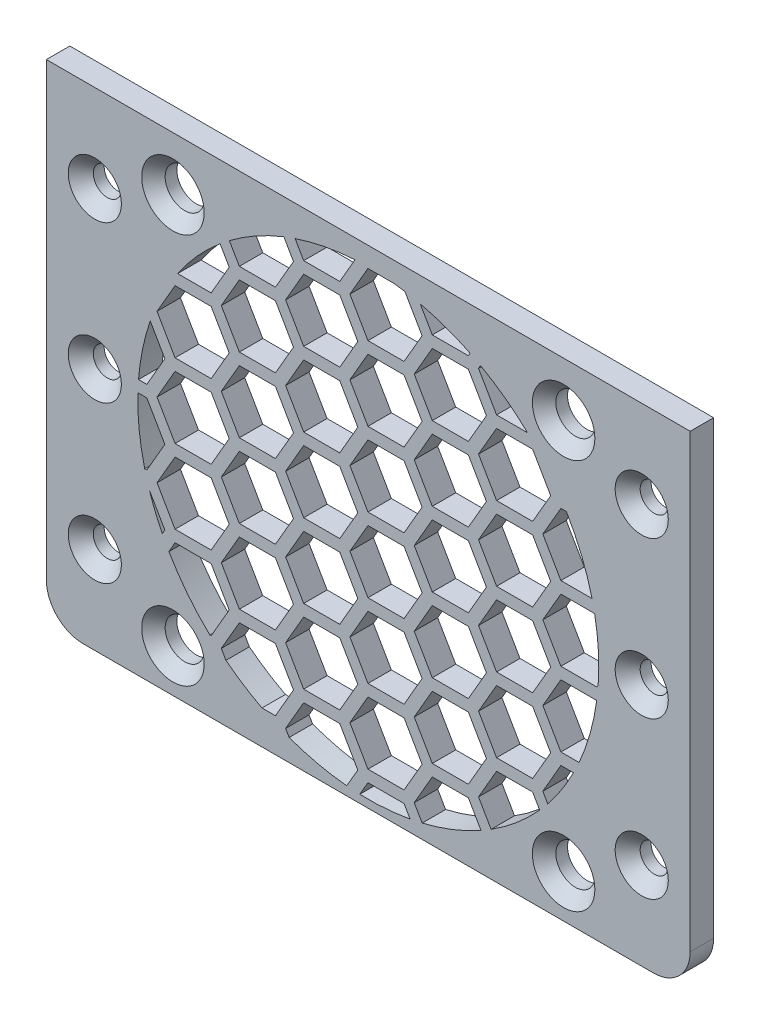
from build123d import *

# Parameters (mm, degrees)
SKETCH1_W                                       = 11
SKETCH1_H                                       = 63
SKETCH1_W_2                                     = 60
SKETCH1_H_2                                     = 60
BOSS_EXTRUDE1_DEPTH                             = 3
CSK_FOR_M3_FLAT_HEAD_MACHINE_SCREW1_D           = 3.6
CSK_FOR_M3_FLAT_HEAD_MACHINE_SCREW1_DEPTH       = 6
CSK_FOR_M3_FLAT_HEAD_MACHINE_SCREW1_CSINK_D     = 6.8
CSK_FOR_M3_FLAT_HEAD_MACHINE_SCREW1_CSINK_ANGLE = 90
CSK_FOR_M3_FLAT_HEAD_MACHINE_SCREW1_TIP         = 1.081549114
FILLET1_R                                       = 5
CUT_EXTRUDE1_DEPTH                              = 96.718336801
CSK_FOR_M4_FLAT_HEAD_MACHINE_SCREW1_D           = 5
CSK_FOR_M4_FLAT_HEAD_MACHINE_SCREW1_DEPTH       = 7
CSK_FOR_M4_FLAT_HEAD_MACHINE_SCREW1_CSINK_D     = 8
CSK_FOR_M4_FLAT_HEAD_MACHINE_SCREW1_CSINK_ANGLE = 90
CSK_FOR_M4_FLAT_HEAD_MACHINE_SCREW1_TIP         = 1.502151548
SKETCH8_R                                       = 29.5
CUT_EXTRUDE2_DEPTH                              = 96.295225484
BOSS_EXTRUDE2_START                             = -3
BOSS_EXTRUDE2_DEPTH                             = 3


# Read off the part's stored shape, not the designer's step: Boss-Extrude2
with BuildPart() as part:
    # Sketch1 → Boss-Extrude1 (new body)
    with BuildSketch(Plane.XY):
        with Locations((-66.5, 31.5)):
            Rectangle(SKETCH1_W, SKETCH1_H)
        Polygon((-60, 60), (0, 60), (0, 63), (-61, 63), (-61, 0), (-60, 0), align=None)
        with Locations((-30, 30)):
            Rectangle(SKETCH1_W_2, SKETCH1_H_2)
        with Locations((5.5, 31.5)):
            Rectangle(SKETCH1_W, SKETCH1_H)
    extrude(amount=BOSS_EXTRUDE1_DEPTH)

    # CSK for M3 Flat Head Machine Screw1
    with Locations(Plane.XY.offset(3)):
        with Locations((-65.5, 31.5), (-65.5, 51.5), (-65.5, 11.5), (4.5, 11.5), (4.5, 31.5), (4.5, 51.5)):
            CounterSinkHole(CSK_FOR_M3_FLAT_HEAD_MACHINE_SCREW1_D / 2, CSK_FOR_M3_FLAT_HEAD_MACHINE_SCREW1_CSINK_D / 2, depth=CSK_FOR_M3_FLAT_HEAD_MACHINE_SCREW1_DEPTH, counter_sink_angle=CSK_FOR_M3_FLAT_HEAD_MACHINE_SCREW1_CSINK_ANGLE)
            with Locations((0, 0, -(CSK_FOR_M3_FLAT_HEAD_MACHINE_SCREW1_DEPTH + CSK_FOR_M3_FLAT_HEAD_MACHINE_SCREW1_TIP / 2))):  # 118° drill point
                Cone(0, CSK_FOR_M3_FLAT_HEAD_MACHINE_SCREW1_D / 2, CSK_FOR_M3_FLAT_HEAD_MACHINE_SCREW1_TIP, mode=Mode.SUBTRACT)

    # Fillet1
    fillet1_edges = [part.edges().sort_by_distance(p)[0] for p in [
        (11, 0, 1.5),
        (-72, 0, 1.5),
    ]]
    fillet(fillet1_edges, radius=FILLET1_R)

    # Sketch4 → Cut-Extrude1 (cut, through all)
    with BuildSketch(Plane.XY.offset(3)):
        with BuildLine():
            Line((11, 5), (11, 63))
            Line((11, 63), (-72, 63))
            Line((-72, 63), (-72, 5))
            ThreePointArc((-72, 5), (-70.535533906, 1.464466094), (-67, 0))
            Line((-67, 0), (6, 0))
            ThreePointArc((6, 0), (9.535533906, 1.464466094), (11, 5))
        make_face()
        with BuildLine():
            Line((10.7, 5), (10.7, 62.7))
            Line((10.7, 62.7), (-71.7, 62.7))
            Line((-71.7, 62.7), (-71.7, 5))
            ThreePointArc((-71.7, 5), (-70.323401872, 1.676598128), (-67, 0.3))
            Line((-67, 0.3), (6, 0.3))
            ThreePointArc((6, 0.3), (9.323401872, 1.676598128), (10.7, 5))
        make_face(mode=Mode.SUBTRACT)
    extrude(amount=-CUT_EXTRUDE1_DEPTH, mode=Mode.SUBTRACT)

    # CSK for M4 Flat Head Machine Screw1
    with Locations(Plane.XY.offset(3)):
        with Locations((-55.5, 55.8), (-5.5, 55.8), (-5.5, 5.8), (-55.5, 5.8)):
            CounterSinkHole(CSK_FOR_M4_FLAT_HEAD_MACHINE_SCREW1_D / 2, CSK_FOR_M4_FLAT_HEAD_MACHINE_SCREW1_CSINK_D / 2, depth=CSK_FOR_M4_FLAT_HEAD_MACHINE_SCREW1_DEPTH, counter_sink_angle=CSK_FOR_M4_FLAT_HEAD_MACHINE_SCREW1_CSINK_ANGLE)
            with Locations((0, 0, -(CSK_FOR_M4_FLAT_HEAD_MACHINE_SCREW1_DEPTH + CSK_FOR_M4_FLAT_HEAD_MACHINE_SCREW1_TIP / 2))):  # 118° drill point
                Cone(0, CSK_FOR_M4_FLAT_HEAD_MACHINE_SCREW1_D / 2, CSK_FOR_M4_FLAT_HEAD_MACHINE_SCREW1_TIP, mode=Mode.SUBTRACT)

    # Sketch8 → Cut-Extrude2 (cut, through all)
    with BuildSketch(Plane.XY.offset(3)):
        with Locations((-30.5, 30.8)):
            Circle(SKETCH8_R)
    extrude(amount=-CUT_EXTRUDE2_DEPTH, mode=Mode.SUBTRACT)

    # Boss-Extrude2 outline → Boss-Extrude2 (add)
    with BuildSketch(Plane.XY.offset(3).offset(BOSS_EXTRUDE2_START)):
        with BuildLine():
            Line((-5.849401077, 36.375), (-1.531579694, 36.375))
            ThreePointArc((-1.531579694, 36.375), (-1.686509211, 37.127143789), (-1.86096414, 37.875))
            Line((-1.86096414, 37.875), (-5.849401077, 37.875))
            Line((-5.849401077, 37.875), (-8.158802154, 41.875))
            Line((-8.158802154, 41.875), (-5.849401077, 45.875))
            Line((-5.849401077, 45.875), (-5.142666248, 45.875))
            ThreePointArc((-5.142666248, 45.875), (-7.416982651, 49.169112936), (-10.116320867, 52.125))
            Line((-10.116320867, 52.125), (-14.082159741, 52.125))
            Line((-14.082159741, 52.125), (-16.391560818, 56.125))
            Line((-16.391560818, 56.125), (-16.136389783, 56.566969196))
            ThreePointArc((-16.136389783, 56.566969196), (-16.796670475, 56.924103046), (-17.465824519, 57.264320689))
            Line((-17.465824519, 57.264320689), (-17.690598923, 56.875))
            Line((-17.690598923, 56.875), (-22.309401077, 56.875))
            Line((-22.309401077, 56.875), (-23.848199791, 59.540277556))
            ThreePointArc((-23.848199791, 59.540277556), (-24.824620536, 59.748921706), (-25.80754281, 59.924402921))
            Line((-25.80754281, 59.924402921), (-23.613956511, 56.125))
            Line((-23.613956511, 56.125), (-25.923357587, 52.125))
            Line((-25.923357587, 52.125), (-30.542159741, 52.125))
            Line((-30.542159741, 52.125), (-32.851560818, 56.125))
            Line((-32.851560818, 56.125), (-30.542159741, 60.125))
            Line((-30.542159741, 60.125), (-27.291515155, 60.125))
            ThreePointArc((-27.291515155, 60.125), (-29.743897611, 60.290308733), (-32.20152913, 60.250887909))
            Line((-32.20152913, 60.250887909), (-34.150598923, 56.875))
            Line((-34.150598923, 56.875), (-38.769401077, 56.875))
            Line((-38.769401077, 56.875), (-39.865679548, 58.773810012))
            ThreePointArc((-39.865679548, 58.773810012), (-40.587020298, 58.521869012), (-41.301594176, 58.25133081))
            Line((-41.301594176, 58.25133081), (-40.073956511, 56.125))
            Line((-40.073956511, 56.125), (-42.383357587, 52.125))
            Line((-42.383357587, 52.125), (-47.002159741, 52.125))
            Line((-47.002159741, 52.125), (-48.280604386, 54.33933108))
            ThreePointArc((-48.280604386, 54.33933108), (-48.879893301, 53.874434386), (-49.467032243, 53.394284408))
            Line((-49.467032243, 53.394284408), (-48.301197846, 51.375))
            Line((-48.301197846, 51.375), (-50.610598923, 47.375))
            Line((-50.610598923, 47.375), (-54.903265663, 47.375))
            ThreePointArc((-54.903265663, 47.375), (-56.888142818, 43.987718477), (-58.405646971, 40.366862973))
            Line((-58.405646971, 40.366862973), (-56.533956511, 37.125))
            Line((-56.533956511, 37.125), (-58.843357587, 33.125))
            Line((-58.843357587, 33.125), (-59.908236516, 33.125))
            ThreePointArc((-59.908236516, 33.125), (-59.957898194, 32.375510718), (-59.988461727, 31.625))
            Line((-59.988461727, 31.625), (-58.843357587, 31.625))
            Line((-58.843357587, 31.625), (-56.533956511, 27.625))
            Line((-56.533956511, 27.625), (-58.843357587, 23.625))
            Line((-58.843357587, 23.625), (-59.114146414, 23.625))
            ThreePointArc((-59.114146414, 23.625), (-58.832742538, 22.583814737), (-58.513466555, 21.55361197))
            Line((-58.513466555, 21.55361197), (-56.533956511, 18.125))
            Line((-56.533956511, 18.125), (-56.861116881, 17.558341616))
            ThreePointArc((-56.861116881, 17.558341616), (-56.452720902, 16.774798475), (-56.021041965, 16.00383776))
            Line((-56.021041965, 16.00383776), (-55.229401077, 17.375))
            Line((-55.229401077, 17.375), (-50.610598923, 17.375))
            Line((-50.610598923, 17.375), (-48.301197846, 13.375))
            Line((-48.301197846, 13.375), (-50.610598923, 9.375))
            Line((-50.610598923, 9.375), (-50.778544696, 9.375))
            ThreePointArc((-50.778544696, 9.375), (-49.769089131, 8.462761942), (-48.718644735, 7.59803922))
            Line((-48.718644735, 7.59803922), (-49.311560818, 8.625))
            Line((-49.311560818, 8.625), (-47.002159741, 12.625))
            Line((-47.002159741, 12.625), (-42.383357587, 12.625))
            Line((-42.383357587, 12.625), (-40.073956511, 8.625))
            Line((-40.073956511, 8.625), (-42.383357587, 4.625))
            Line((-42.383357587, 4.625), (-44.105858113, 4.625))
            ThreePointArc((-44.105858113, 4.625), (-42.391226993, 3.802801616), (-40.627186714, 3.092779113))
            Line((-40.627186714, 3.092779113), (-41.078802154, 3.875))
            Line((-41.078802154, 3.875), (-38.769401077, 7.875))
            Line((-38.769401077, 7.875), (-34.150598923, 7.875))
            Line((-34.150598923, 7.875), (-31.841197846, 3.875))
            Line((-31.841197846, 3.875), (-33.253519364, 1.428787374))
            ThreePointArc((-33.253519364, 1.428787374), (-32.419688772, 1.362527367), (-31.584314789, 1.319934508))
            Line((-31.584314789, 1.319934508), (-30.542159741, 3.125))
            Line((-30.542159741, 3.125), (-25.923357587, 3.125))
            Line((-25.923357587, 3.125), (-25.151919029, 1.788829222))
            ThreePointArc((-25.151919029, 1.788829222), (-24.375762939, 1.942700743), (-23.604012885, 2.117333428))
            Line((-23.604012885, 2.117333428), (-24.618802154, 3.875))
            Line((-24.618802154, 3.875), (-22.309401077, 7.875))
            Line((-22.309401077, 7.875), (-17.690598923, 7.875))
            Line((-17.690598923, 7.875), (-16.070920795, 5.069635189))
            ThreePointArc((-16.070920795, 5.069635189), (-15.421369208, 5.444825115), (-14.781567137, 5.836409146))
            Line((-14.781567137, 5.836409146), (-16.391560818, 8.625))
            Line((-16.391560818, 8.625), (-14.082159741, 12.625))
            Line((-14.082159741, 12.625), (-9.463357587, 12.625))
            Line((-9.463357587, 12.625), (-8.566841366, 11.072188354))
            ThreePointArc((-8.566841366, 11.072188354), (-8.040841719, 11.673154748), (-7.531303163, 12.288139866))
            Line((-7.531303163, 12.288139866), (-8.158802154, 13.375))
            Line((-8.158802154, 13.375), (-5.849401077, 17.375))
            Line((-5.849401077, 17.375), (-4.231780133, 17.375))
            ThreePointArc((-4.231780133, 17.375), (-3.864180165, 18.119972331), (-3.517702563, 18.875))
            Line((-3.517702563, 18.875), (-5.849401077, 18.875))
            Line((-5.849401077, 18.875), (-8.158802154, 22.875))
            Line((-8.158802154, 22.875), (-5.849401077, 26.875))
            Line((-5.849401077, 26.875), (-1.262278218, 26.875))
            ThreePointArc((-1.262278218, 26.875), (-1.157619859, 27.754556242), (-1.079415079, 28.6368581))
            Line((-1.079415079, 28.6368581), (-1.230598923, 28.375))
            Line((-1.230598923, 28.375), (-5.849401077, 28.375))
            Line((-5.849401077, 28.375), (-8.158802154, 32.375))
            Line((-8.158802154, 32.375), (-5.849401077, 36.375))
        make_face()
        Polygon((-31.841197846, 13.375), (-34.150598923, 9.375), (-38.769401077, 9.375), (-41.078802154, 13.375), (-38.769401077, 17.375), (-34.150598923, 17.375), align=None, mode=Mode.SUBTRACT)
        Polygon((-55.229401077, 26.875), (-50.610598923, 26.875), (-48.301197846, 22.875), (-50.610598923, 18.875), (-55.229401077, 18.875), (-57.538802154, 22.875), align=None, mode=Mode.SUBTRACT)
        Polygon((-47.002159741, 22.125), (-42.383357587, 22.125), (-40.073956511, 18.125), (-42.383357587, 14.125), (-47.002159741, 14.125), (-49.311560818, 18.125), align=None, mode=Mode.SUBTRACT)
        Polygon((-31.841197846, 22.875), (-34.150598923, 18.875), (-38.769401077, 18.875), (-41.078802154, 22.875), (-38.769401077, 26.875), (-34.150598923, 26.875), align=None, mode=Mode.SUBTRACT)
        Polygon((-47.002159741, 31.625), (-42.383357587, 31.625), (-40.073956511, 27.625), (-42.383357587, 23.625), (-47.002159741, 23.625), (-49.311560818, 27.625), align=None, mode=Mode.SUBTRACT)
        Polygon((-25.923357587, 12.625), (-23.613956511, 8.625), (-25.923357587, 4.625), (-30.542159741, 4.625), (-32.851560818, 8.625), (-30.542159741, 12.625), align=None, mode=Mode.SUBTRACT)
        Polygon((-15.381197846, 13.375), (-17.690598923, 9.375), (-22.309401077, 9.375), (-24.618802154, 13.375), (-22.309401077, 17.375), (-17.690598923, 17.375), align=None, mode=Mode.SUBTRACT)
        Polygon((-25.923357587, 22.125), (-23.613956511, 18.125), (-25.923357587, 14.125), (-30.542159741, 14.125), (-32.851560818, 18.125), (-30.542159741, 22.125), align=None, mode=Mode.SUBTRACT)
        Polygon((-22.309401077, 26.875), (-17.690598923, 26.875), (-15.381197846, 22.875), (-17.690598923, 18.875), (-22.309401077, 18.875), (-24.618802154, 22.875), align=None, mode=Mode.SUBTRACT)
        Polygon((-23.613956511, 27.625), (-25.923357587, 23.625), (-30.542159741, 23.625), (-32.851560818, 27.625), (-30.542159741, 31.625), (-25.923357587, 31.625), align=None, mode=Mode.SUBTRACT)
        Polygon((-9.463357587, 22.125), (-7.153956511, 18.125), (-9.463357587, 14.125), (-14.082159741, 14.125), (-16.391560818, 18.125), (-14.082159741, 22.125), align=None, mode=Mode.SUBTRACT)
        Polygon((-14.082159741, 31.625), (-9.463357587, 31.625), (-7.153956511, 27.625), (-9.463357587, 23.625), (-14.082159741, 23.625), (-16.391560818, 27.625), align=None, mode=Mode.SUBTRACT)
        Polygon((-55.229401077, 36.375), (-50.610598923, 36.375), (-48.301197846, 32.375), (-50.610598923, 28.375), (-55.229401077, 28.375), (-57.538802154, 32.375), align=None, mode=Mode.SUBTRACT)
        Polygon((-55.229401077, 45.875), (-50.610598923, 45.875), (-48.301197846, 41.875), (-50.610598923, 37.875), (-55.229401077, 37.875), (-57.538802154, 41.875), align=None, mode=Mode.SUBTRACT)
        Polygon((-47.002159741, 41.125), (-42.383357587, 41.125), (-40.073956511, 37.125), (-42.383357587, 33.125), (-47.002159741, 33.125), (-49.311560818, 37.125), align=None, mode=Mode.SUBTRACT)
        Polygon((-31.841197846, 32.375), (-34.150598923, 28.375), (-38.769401077, 28.375), (-41.078802154, 32.375), (-38.769401077, 36.375), (-34.150598923, 36.375), align=None, mode=Mode.SUBTRACT)
        Polygon((-34.150598923, 45.875), (-31.841197846, 41.875), (-34.150598923, 37.875), (-38.769401077, 37.875), (-41.078802154, 41.875), (-38.769401077, 45.875), align=None, mode=Mode.SUBTRACT)
        Polygon((-47.002159741, 50.625), (-42.383357587, 50.625), (-40.073956511, 46.625), (-42.383357587, 42.625), (-47.002159741, 42.625), (-49.311560818, 46.625), align=None, mode=Mode.SUBTRACT)
        Polygon((-34.150598923, 55.375), (-31.841197846, 51.375), (-34.150598923, 47.375), (-38.769401077, 47.375), (-41.078802154, 51.375), (-38.769401077, 55.375), align=None, mode=Mode.SUBTRACT)
        Polygon((-23.613956511, 37.125), (-25.923357587, 33.125), (-30.542159741, 33.125), (-32.851560818, 37.125), (-30.542159741, 41.125), (-25.923357587, 41.125), align=None, mode=Mode.SUBTRACT)
        Polygon((-22.309401077, 36.375), (-17.690598923, 36.375), (-15.381197846, 32.375), (-17.690598923, 28.375), (-22.309401077, 28.375), (-24.618802154, 32.375), align=None, mode=Mode.SUBTRACT)
        Polygon((-22.309401077, 45.875), (-17.690598923, 45.875), (-15.381197846, 41.875), (-17.690598923, 37.875), (-22.309401077, 37.875), (-24.618802154, 41.875), align=None, mode=Mode.SUBTRACT)
        Polygon((-14.082159741, 41.125), (-9.463357587, 41.125), (-7.153956511, 37.125), (-9.463357587, 33.125), (-14.082159741, 33.125), (-16.391560818, 37.125), align=None, mode=Mode.SUBTRACT)
        Polygon((-23.613956511, 46.625), (-25.923357587, 42.625), (-30.542159741, 42.625), (-32.851560818, 46.625), (-30.542159741, 50.625), (-25.923357587, 50.625), align=None, mode=Mode.SUBTRACT)
        Polygon((-22.309401077, 55.375), (-17.690598923, 55.375), (-15.381197846, 51.375), (-17.690598923, 47.375), (-22.309401077, 47.375), (-24.618802154, 51.375), align=None, mode=Mode.SUBTRACT)
        Polygon((-7.153956511, 46.625), (-9.463357587, 42.625), (-14.082159741, 42.625), (-16.391560818, 46.625), (-14.082159741, 50.625), (-9.463357587, 50.625), align=None, mode=Mode.SUBTRACT)
    extrude(amount=BOSS_EXTRUDE2_DEPTH)


solid = part.part
